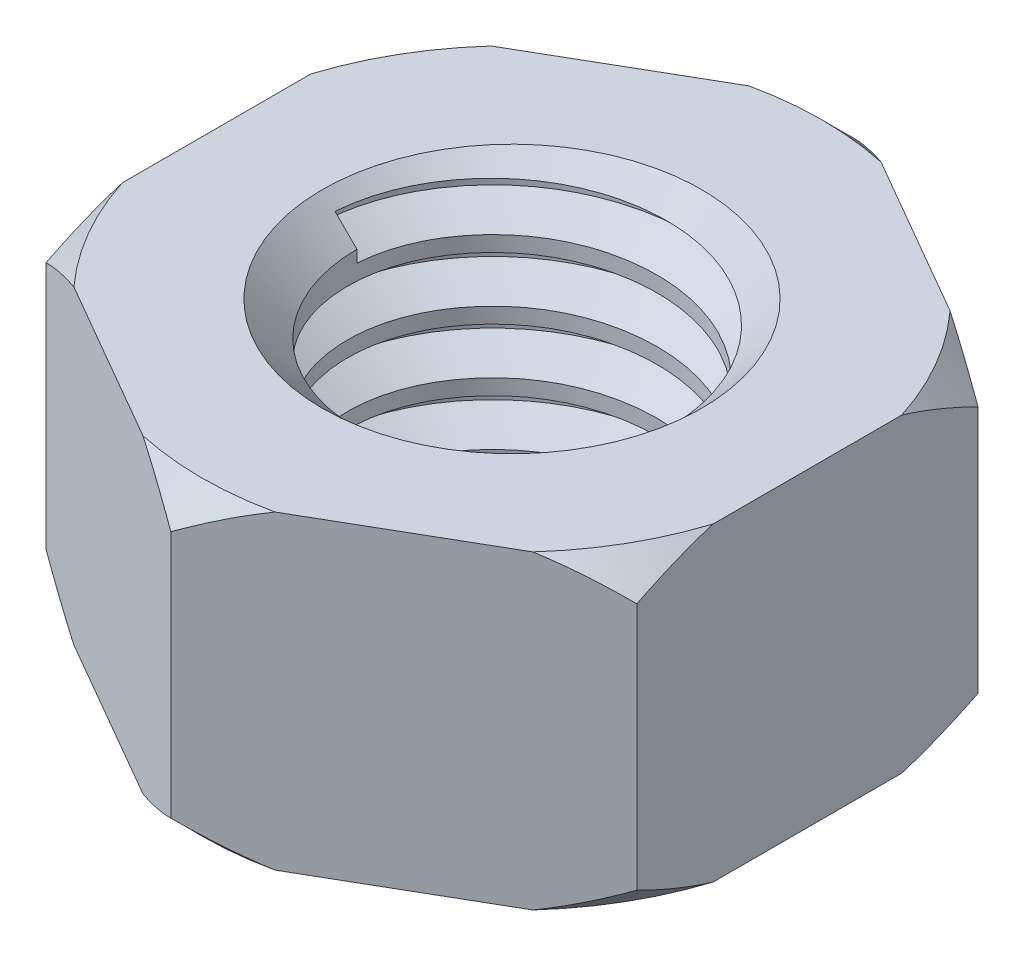
from build123d import *

# Parameters (mm, degrees)
BOSS_EXTRUDE1_DEPTH = 5
SKETCH5_R           = 2.5
CUT_EXTRUDE1_DEPTH  = 9.828221792
THREAD1_PITCH       = 1


with BuildPart() as part:
    # Sketch2 → Boss-Extrude1 (new body)
    with BuildSketch(Plane(origin=(0, 0, 0), x_dir=(1, 0, 0), z_dir=(0, 1, 0))):
        Polygon((0, 5.5), (-4.763139721, 2.75), (-4.763139721, -2.75), (0, -5.5), (4.763139721, -2.75), (4.763139721, 2.75), align=None)
    extrude(amount=BOSS_EXTRUDE1_DEPTH)

    # Sketch3 → Cut-Revolve2 (revolve, cut)
    with BuildSketch(Plane(origin=(0, 0, 0), x_dir=(0, 0, -1), z_dir=(1, 0, 0))):
        with BuildLine():
            Line((5.5, 4.5), (5, 5))
            ThreePointArc((5, 5), (5.5, 5), (5.5, 4.5))
        make_face()
        with BuildLine():
            Line((5.5, 0.5), (5, 0))
            ThreePointArc((5, 0), (5.5, 0), (5.5, 0.5))
        make_face()
    revolve(axis=Axis((0, 6.55138095, 0), (0, -1, 0)), mode=Mode.SUBTRACT)

    # Sketch5 → Cut-Extrude1 (cut, through all)
    with BuildSketch(Plane(origin=(0, 5, 0), x_dir=(1, 0, 0), z_dir=(0, 1, 0))):
        with Locations(Location((0, 0, 0), (0, 0, 270))):
            Circle(SKETCH5_R)
    extrude(amount=-CUT_EXTRUDE1_DEPTH, mode=Mode.SUBTRACT)

    # Thread1: the profile of Thread Profile1 profile screwed along a right-hand helix of 13 turns, 8 arcs to a turn; built about Z, then put on its axis
    thread1_z = Axis((0, 0, 0), (0, 0, 1))
    thread1_corners = [(2.4997, 0, -0.000173205), (3.041265875, 0, 0.312499999), (3.041265875, 0, 0.437499999), (2.4997, 0, 0.750173202)]
    with BuildLine(mode=Mode.PRIVATE) as thread1_profile:
        Line(thread1_corners[0], thread1_corners[1])
        Line(thread1_corners[1], thread1_corners[2])
        Line(thread1_corners[2], thread1_corners[3])
        Line(thread1_corners[3], thread1_corners[0])
    thread1_cap = Face(thread1_profile.wire())
    thread1_turn_angles = [0, 22.5, 45, 67.5, 90, 112.5, 135, 157.5, 180, 202.5, 225, 247.5, 270, 292.5, 315, 337.5, 360]
    thread1_turn_weights = [1, 0.9238795325112867, 1, 0.9238795325112867, 1, 0.9238795325112867, 1, 0.9238795325112867, 1, 0.9238795325112867, 1, 0.9238795325112867, 1, 0.9238795325112867, 1, 0.9238795325112867, 1]
    thread1_turn_rails = [Edge.make_bspline([Vector(p[0], p[1], 0).rotate(thread1_z, thread1_turn_angles[k]) / thread1_turn_weights[k] + Vector(0, 0, p[2] + THREAD1_PITCH * thread1_turn_angles[k] / 360) for k in range(17)], [0, 0, 0, 1, 1, 2, 2, 3, 3, 4, 4, 5, 5, 6, 6, 7, 7, 8, 8, 8], 2, thread1_turn_weights) for p in thread1_corners]
    thread1_turn_sides = [Face.make_surface_from_curves(thread1_turn_rails[p[0]], thread1_turn_rails[p[1]]) for p in [(0, 1), (1, 2), (2, 3), (3, 0)]]
    thread1 = Plane(origin=(0, 5, 0), x_dir=(-1, 0, 0), z_dir=(0, -1, 0)) * Solid(Shell([*[p.moved(Location((0, 0, THREAD1_PITCH * i))) for i in range(13) for p in thread1_turn_sides], thread1_cap, thread1_cap.rotate(thread1_z, 4680).moved(Location((0, 0, THREAD1_PITCH * 4680 / 360)))]))
    add(thread1, mode=Mode.SUBTRACT)

    # Sketch10 → Cut-Revolve3 (revolve, cut)
    with BuildSketch(Plane(origin=(0, 0, 0), x_dir=(0, 0, -1), z_dir=(1, 0, 0))):
        Polygon((-2.359867454, 5.44761041), (-2.359867454, 4.30331112), (-3.593298639, 5.536742304), align=None)
        Polygon((-3.593298639, -0.536742304), (-2.359867454, -0.44761041), (-2.359867454, 0.69668888), align=None)
    revolve(axis=Axis((0, 6.458982176, 0), (0, -1, 0)), mode=Mode.SUBTRACT)


solid = part.part
